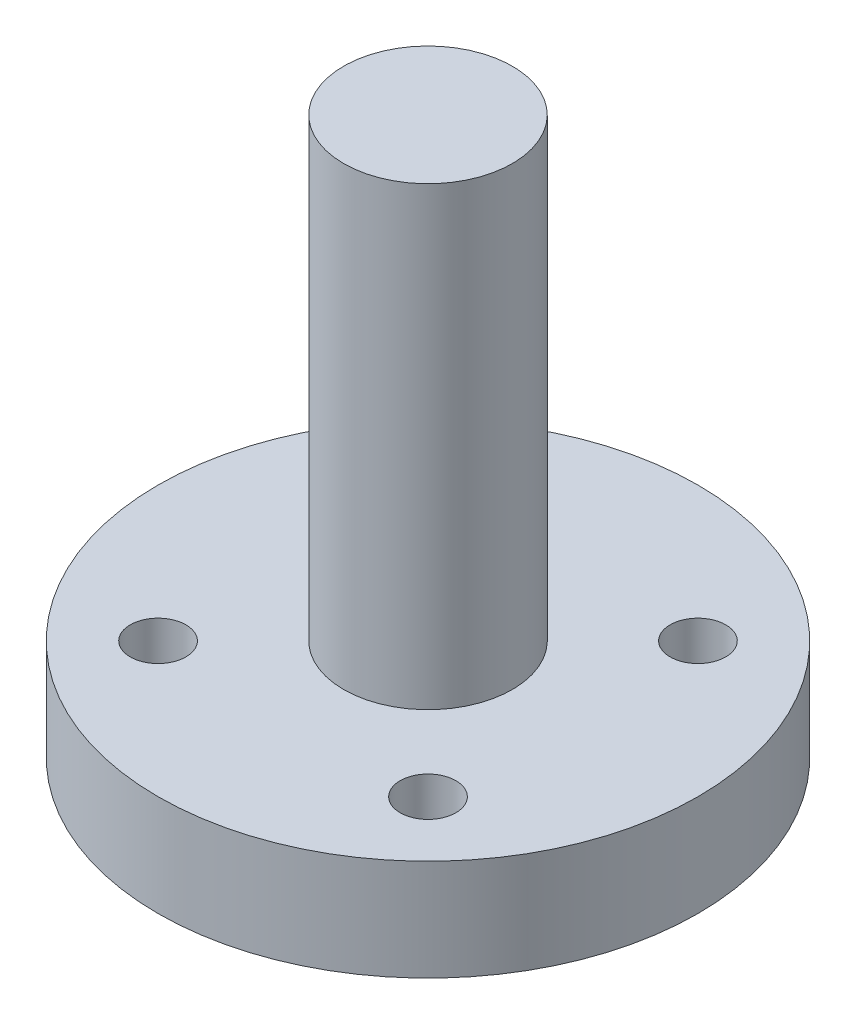
from build123d import *

# Parameters (mm, degrees)
SKETCH1_R                   = 16
BOSS_EXTRUDE1_DEPTH         = 6
TAP_DRILL_FOR_M4X0_7_TAP1_D = 3.3
SKETCH3_R                   = 5
BOSS_EXTRUDE2_DEPTH         = 27


with BuildPart() as part:
    # Sketch1 → Boss-Extrude1 (new body)
    with BuildSketch(Plane(origin=(0, 0, 0), x_dir=(1, 0, 0), z_dir=(0, 1, 0))):
        Circle(SKETCH1_R)
    extrude(amount=BOSS_EXTRUDE1_DEPTH)

    # Tap Drill for M4x0.7 Tap1 (through all)
    with Locations(Plane(origin=(0, 0, 0), x_dir=(-1, 0, 0), z_dir=(0, -1, 0))):
        with Locations((-8, 8), (-8, -8), (8, -8), (8, 8)):
            Hole(TAP_DRILL_FOR_M4X0_7_TAP1_D / 2)

    # Sketch3 → Boss-Extrude2 (add)
    with BuildSketch(Plane(origin=(0, 6, 0), x_dir=(1, 0, 0), z_dir=(0, 1, 0))):
        Circle(SKETCH3_R)
    extrude(amount=BOSS_EXTRUDE2_DEPTH)


solid = part.part
